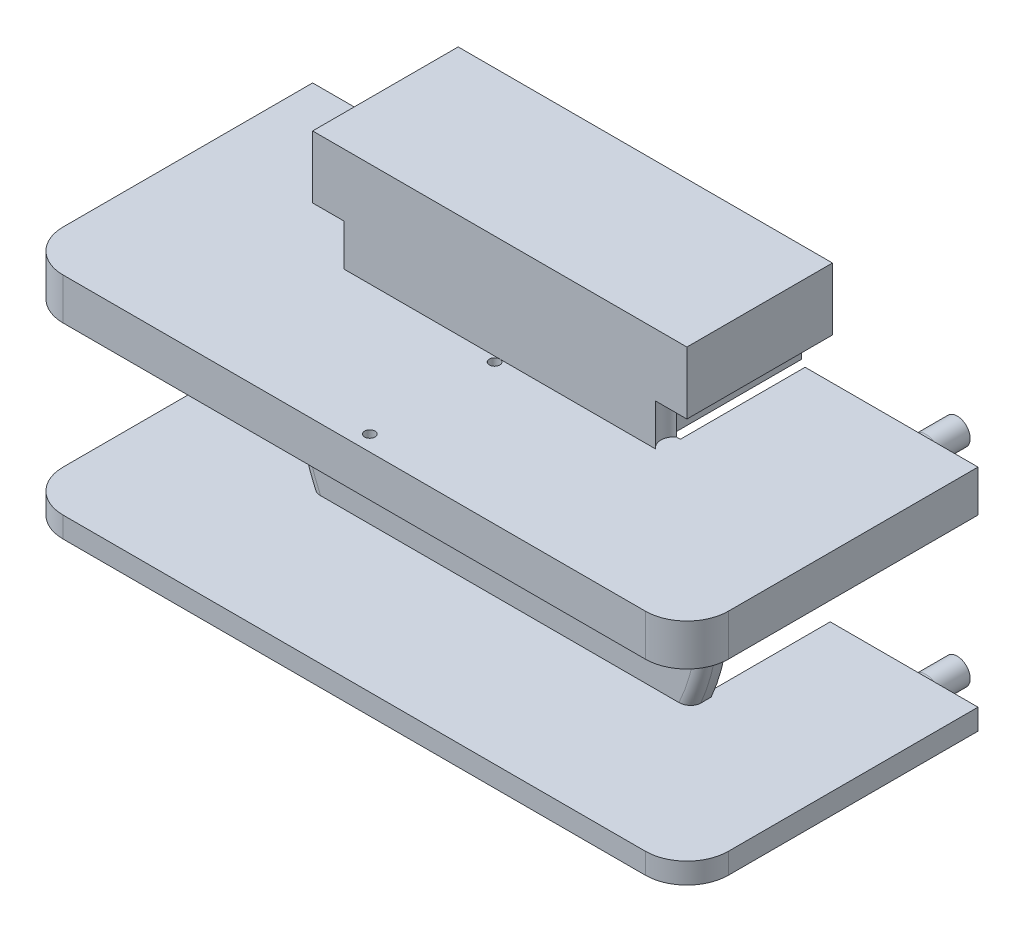
from build123d import *

# Parameters (mm, degrees)
BOSS_EXTRUDE1_DEPTH     = 1
SKETCH2_R               = 1.51
BOSS_EXTRUDE2_DEPTH     = 5.5
SKETCH3_R               = 3.5
BOSS_EXTRUDE3_DEPTH     = 1
SKETCH4_W               = 2
SKETCH4_H               = 17
BOSS_EXTRUDE4_DEPTH     = 6
SKETCH5_W               = 18
SKETCH5_H               = 2
BOSS_EXTRUDE5_DEPTH     = 6
SKETCH6_W               = 7
SKETCH6_H               = 2
BOSS_EXTRUDE6_DEPTH     = 5
BOSS_EXTRUDE7_DEPTH     = 6
CUT_EXTRUDE1_DEPTH      = 21.639767441
SKETCH9_W               = 2.937742252
SKETCH9_H               = 8
CUT_EXTRUDE2_DEPTH      = 6
CUT_EXTRUDE11_START     = -6
SKETCH21_R              = 9.75
SKETCH21_R_2            = 3.5
CUT_EXTRUDE11_DEPTH     = 6
SKETCH10_W              = 32
SKETCH10_H              = 2
BOSS_EXTRUDE8_DEPTH     = 7
FILLET1_R               = 0.5
SKETCH11_R              = 0.625
BOSS_EXTRUDE9_DEPTH     = 2
SKETCH14_W              = 3.5
SKETCH14_H              = 2
CUT_EXTRUDE5_DEPTH      = 24.937418532
SKETCH12_R              = 0.675
CUT_EXTRUDE3_DEPTH      = 2.5
CUT_EXTRUDE6_DEPTH      = 2
FILLET2_R               = 0.5
FILLET3_R               = 0.5
FILLET4_R               = 2
CUT_EXTRUDE7_DEPTH      = 25.677925456
CUT_EXTRUDE7_DEPTH_BACK = 1
SKETCH19_R              = 0.25
CUT_EXTRUDE9_DEPTH      = 2
SKETCH20_W              = 2
SKETCH20_H              = 3
CUT_EXTRUDE10_DEPTH     = 24.937418532


with BuildPart() as part:
    # Sketch1 → Boss-Extrude1 (new body)
    with BuildSketch(Plane.XY):
        Polygon((-11, 6), (-11, 11), (11, 11), (11, 6), (11, -6), (-11, -6), align=None)
    extrude(amount=BOSS_EXTRUDE1_DEPTH)

    # Sketch2 → Boss-Extrude2 (add)
    with BuildSketch(Plane(origin=(0, 0, 0), x_dir=(-1, 0, 0), z_dir=(0, 0, -1))):
        with Locations(Location((0, 0, 0), (0, 0, 180))):
            Circle(SKETCH2_R)
    extrude(amount=BOSS_EXTRUDE2_DEPTH)

    # Sketch3 → Boss-Extrude3 (add)
    with BuildSketch(Plane(origin=(0, 0, 0), x_dir=(-1, 0, 0), z_dir=(0, 0, -1))):
        with Locations(Location((0, 0, 0), (0, 0, 180))):
            Circle(SKETCH3_R)
    extrude(amount=BOSS_EXTRUDE3_DEPTH)

    # Sketch4 → Boss-Extrude4 (add)
    with BuildSketch(Plane(origin=(0, 0, 0), x_dir=(-1, 0, 0), z_dir=(0, 0, -1))):
        with Locations((10, 2.5)):
            Rectangle(SKETCH4_W, SKETCH4_H)
        with Locations((-10, 2.5)):
            Rectangle(SKETCH4_W, SKETCH4_H)
    extrude(amount=BOSS_EXTRUDE4_DEPTH)

    # Sketch5 → Boss-Extrude5 (add)
    with BuildSketch(Plane(origin=(0, 0, 0), x_dir=(-1, 0, 0), z_dir=(0, 0, -1))):
        with Locations((0, 10)):
            Rectangle(SKETCH5_W, SKETCH5_H)
    extrude(amount=BOSS_EXTRUDE5_DEPTH)

    # Sketch6 → Boss-Extrude6 (add)
    with BuildSketch(Plane(origin=(11, 0, 0), x_dir=(0, 0, -1), z_dir=(1, 0, 0))):
        with Locations((2.5, -5)):
            Rectangle(SKETCH6_W, SKETCH6_H)
        with Locations((2.5, 5)):
            Rectangle(SKETCH6_W, SKETCH6_H)
    boss_extrude6 = extrude(amount=BOSS_EXTRUDE6_DEPTH)

    # Mirror1: Boss-Extrude6 across plane
    add(boss_extrude6.mirror(Plane(origin=(0, 0, 0), x_dir=(0, 0, 1), z_dir=(1, 0, 0))))

    # Sketch7 → Boss-Extrude7 (add)
    with BuildSketch(Plane(origin=(0, 0, -6), x_dir=(-1, 0, 0), z_dir=(0, 0, -1))):
        with BuildLine():
            ThreePointArc((-6.708203932, -6), (-8.407551231, -3.211398808), (-9, 0))
            Line((-9, 0), (-9, -6))
            Line((-9, -6), (-6.708203932, -6))
        make_face()
        with BuildLine():
            Line((-9, 9), (-9, 0))
            ThreePointArc((-9, 0), (-6.363961031, 6.363961031), (0, 9))
            Line((0, 9), (-9, 9))
        make_face()
    boss_extrude7 = extrude(amount=-BOSS_EXTRUDE7_DEPTH)

    # Sketch8 → Cut-Extrude1 (cut, through all)
    with BuildSketch(Plane(origin=(0, 0, -6), x_dir=(-1, 0, 0), z_dir=(0, 0, -1))):
        with BuildLine():
            Line((-11, 4), (-9.16515139, 4))
            ThreePointArc((-9.16515139, 4), (-10, 0), (-9.16515139, -4))
            Line((-9.16515139, -4), (-11, -4))
            Line((-11, -4), (-11, 4))
        make_face()
    cut_extrude1 = extrude(amount=-CUT_EXTRUDE1_DEPTH, mode=Mode.SUBTRACT)

    # Sketch9 → Cut-Extrude2 (cut)
    with BuildSketch(Plane(origin=(0, 0, -6), x_dir=(-1, 0, 0), z_dir=(0, 0, -1))):
        with Locations((-9.531128874, 0)):
            Rectangle(SKETCH9_W, SKETCH9_H)
    cut_extrude2 = extrude(amount=-CUT_EXTRUDE2_DEPTH, mode=Mode.SUBTRACT)

    # Mirror2: Boss-Extrude7, Cut-Extrude1, Cut-Extrude2 across plane
    add(boss_extrude7.mirror(Plane(origin=(0, 0, 0), x_dir=(0, 0, 1), z_dir=(1, 0, 0))))
    add(cut_extrude1.mirror(Plane(origin=(0, 0, 0), x_dir=(0, 0, 1), z_dir=(1, 0, 0))), mode=Mode.SUBTRACT)
    add(cut_extrude2.mirror(Plane(origin=(0, 0, 0), x_dir=(0, 0, 1), z_dir=(1, 0, 0))), mode=Mode.SUBTRACT)

    # Sketch21 → Cut-Extrude11 (cut)
    with BuildSketch(Plane(origin=(0, 0, -6), x_dir=(-1, 0, 0), z_dir=(0, 0, -1)).offset(CUT_EXTRUDE11_START)):
        Circle(SKETCH21_R)
        with Locations(Location((0, 0, 0), (0, 0, 180))):
            Circle(SKETCH21_R_2, mode=Mode.SUBTRACT)
    extrude(amount=CUT_EXTRUDE11_DEPTH, mode=Mode.SUBTRACT)

    # Sketch10 → Boss-Extrude8 (add)
    with BuildSketch(Plane.XY.offset(1)):
        with Locations((0, -5)):
            Rectangle(SKETCH10_W, SKETCH10_H)
        with Locations((0, 5)):
            Rectangle(SKETCH10_W, SKETCH10_H)
    extrude(amount=BOSS_EXTRUDE8_DEPTH)

    # Fillet1
    fillet1_edges = [part.edges().sort_by_distance(p)[0] for p in [
        (10, 0, 1),
        (-10, 0, 1),
    ]]
    fillet(fillet1_edges, radius=FILLET1_R)

    # Sketch11 → Boss-Extrude9 (add)
    with BuildSketch(Plane(origin=(0, 0, -6), x_dir=(-1, 0, 0), z_dir=(0, 0, -1))):
        with Locations(Location((-13, -5, 0), (0, 0, 180))):
            Circle(SKETCH11_R)
    boss_extrude9 = extrude(amount=BOSS_EXTRUDE9_DEPTH)

    # Sketch14 → Cut-Extrude5 (cut, through all)
    with BuildSketch(Plane(origin=(0, 0, -6), x_dir=(-1, 0, 0), z_dir=(0, 0, -1))):
        with Locations((9.25, 7)):
            Rectangle(SKETCH14_W, SKETCH14_H)
        with Locations((-9.25, 7)):
            Rectangle(SKETCH14_W, SKETCH14_H)
    extrude(amount=-CUT_EXTRUDE5_DEPTH, mode=Mode.SUBTRACT)

    # Sketch12 → Cut-Extrude3 (cut)
    with BuildSketch(Plane(origin=(0, 0, -6), x_dir=(-1, 0, 0), z_dir=(0, 0, -1))):
        with Locations((13, -5)):
            Circle(SKETCH12_R)
    cut_extrude3 = extrude(amount=-CUT_EXTRUDE3_DEPTH, mode=Mode.SUBTRACT)

    # Sketch16 → Cut-Extrude6 (cut)
    with BuildSketch(Plane(origin=(0, 6, 0), x_dir=(1, 0, 0), z_dir=(0, 1, 0))):
        with BuildLine():
            Line((-7.5, 0), (-7.5, -1))
            ThreePointArc((-7.5, -1), (-7.25, -0.5), (-7.5, 0))
        make_face()
    cut_extrude6 = extrude(amount=CUT_EXTRUDE6_DEPTH, mode=Mode.SUBTRACT)

    # Mirror3: Boss-Extrude9, Cut-Extrude3 across plane
    add(boss_extrude9.mirror(Plane.ZX))
    add(cut_extrude3.mirror(Plane.ZX), mode=Mode.SUBTRACT)

    # Mirror4: Cut-Extrude6 across plane
    add(cut_extrude6.mirror(Plane(origin=(0, 0, 0), x_dir=(0, 0, 1), z_dir=(1, 0, 0))), mode=Mode.SUBTRACT)

    # Fillet2
    fillet2_edges = [part.edges().sort_by_distance(p)[0] for p in [
        (12.375, -5, -6),
        (12.375, 5, -6),
    ]]
    fillet(fillet2_edges, radius=FILLET2_R)

    # Fillet3
    # the kernel refuses this fillet: 0.5 mm, written as the material it takes off along each edge
    with BuildSketch(Plane(origin=(-13, -5, -6), x_dir=(-1, 0, 0), z_dir=(0, -1, 0))) as fillet3_piece_1:
        with BuildLine():
            CenterArc((0.675 + FILLET3_R, -FILLET3_R), FILLET3_R, 90, 90)
            Line((0.675, -FILLET3_R), (0.675, 0))
            Line((0.675, 0), (0.675 + FILLET3_R, 0))
        make_face()
    revolve(axis=Axis((-13, -5, -6), (0, 0, -1)), mode=Mode.SUBTRACT)
    with BuildSketch(Plane(origin=(-13, 5, -6), x_dir=(-1, 0, 0), z_dir=(0, 1, 0))) as fillet3_piece_2:
        with BuildLine():
            CenterArc((0.675 + FILLET3_R, FILLET3_R), FILLET3_R, 180, 90)
            Line((0.675, FILLET3_R), (0.675, 0))
            Line((0.675, 0), (0.675 + FILLET3_R, 0))
        make_face()
    revolve(axis=Axis((-13, 5, -6), (0, 0, 1)), mode=Mode.SUBTRACT)

    # Fillet4
    fillet4_edges = [part.edges().sort_by_distance(p)[0] for p in [
        (16, -5, 8),
        (-16, -5, 8),
        (-16, 5, 8),
        (16, 5, 8),
    ]]
    fillet(fillet4_edges, radius=FILLET4_R)

    # Sketch17 → Cut-Extrude7 (cut, two sides: drawn at the far end of the back side and taken through both)
    with BuildSketch(Plane.XZ.offset(6).offset(-CUT_EXTRUDE7_DEPTH_BACK)):
        with BuildLine():
            Line((-16, 6), (-16, -6))
            Line((-16, -6), (-14.5, -6))
            Line((-14.5, -6), (-14.5, 6))
            ThreePointArc((-14.5, 6), (-14.353553391, 6.353553391), (-14, 6.5))
            Line((-14, 6.5), (14, 6.5))
            ThreePointArc((14, 6.5), (14.353553391, 6.353553391), (14.5, 6))
            Line((14.5, 6), (14.5, -6))
            Line((14.5, -6), (16, -6))
            Line((16, -6), (16, 6))
            ThreePointArc((16, 6), (15.414213562, 7.414213562), (14, 8))
            Line((14, 8), (-14, 8))
            ThreePointArc((-14, 8), (-15.414213562, 7.414213562), (-16, 6))
        make_face()
    extrude(amount=CUT_EXTRUDE7_DEPTH + CUT_EXTRUDE7_DEPTH_BACK, mode=Mode.SUBTRACT)

    # Sketch19 → Cut-Extrude9 (cut)
    with BuildSketch(Plane(origin=(0, 6, 0), x_dir=(1, 0, 0), z_dir=(0, 1, 0))):
        with Locations(Location((0, -1.25, 0), (0, 0, 90))):
            Circle(SKETCH19_R)
        with Locations(Location((0, -7.25, 0), (0, 0, 270))):
            Circle(SKETCH19_R)
    extrude(amount=-CUT_EXTRUDE9_DEPTH, mode=Mode.SUBTRACT)

    # Sketch20 → Cut-Extrude10 (cut, through all)
    with BuildSketch(Plane(origin=(0, 0, -6), x_dir=(-1, 0, 0), z_dir=(0, 0, -1))):
        with Locations((-10, 9.5)):
            Rectangle(SKETCH20_W, SKETCH20_H)
        with Locations((10, 9.5)):
            Rectangle(SKETCH20_W, SKETCH20_H)
    extrude(amount=-CUT_EXTRUDE10_DEPTH, mode=Mode.SUBTRACT)


solid = part.part
